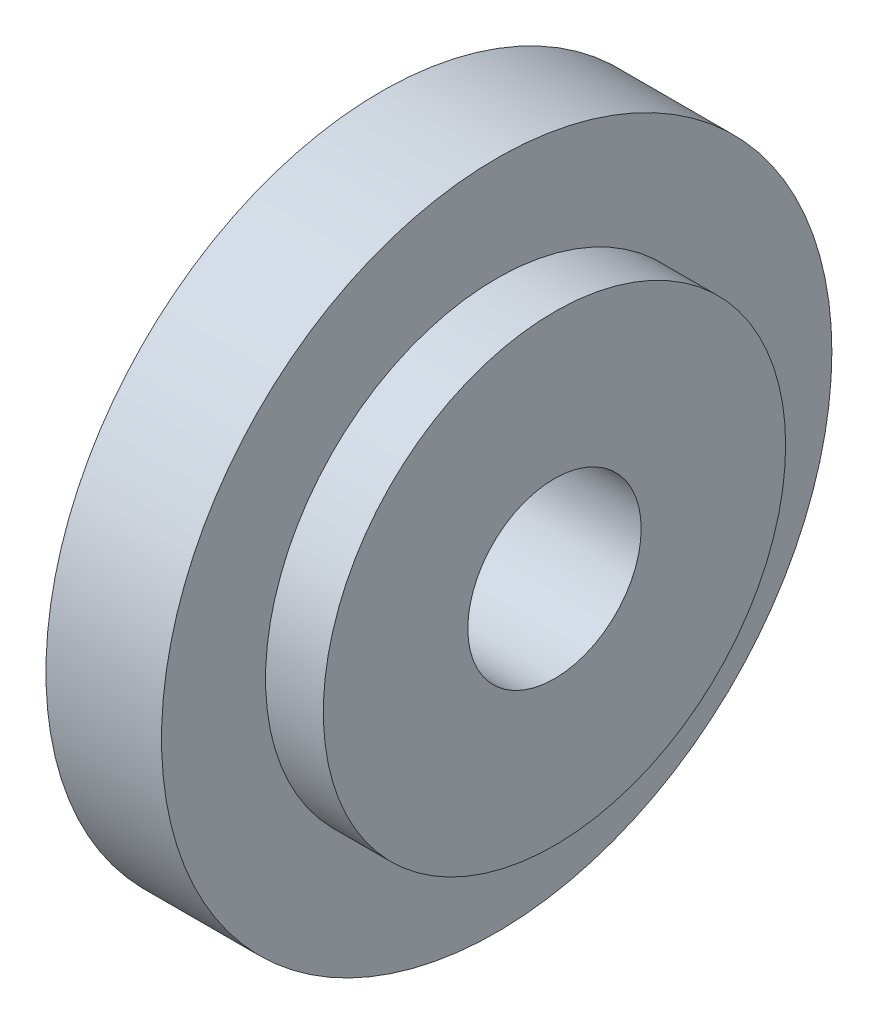
from build123d import *

# Parameters (mm, degrees)
SKETCH1_R           = 5.8
BOSS_EXTRUDE1_DEPTH = 2
SKETCH2_R           = 4
BOSS_EXTRUDE2_DEPTH = 1
SKETCH3_R           = 1.5
CUT_EXTRUDE1_DEPTH  = 20


with BuildPart() as part:
    # Sketch1 → Boss-Extrude1 (new body)
    with BuildSketch(Plane(origin=(0, 0, 0), x_dir=(0, 0, -1), z_dir=(1, 0, 0))):
        Circle(SKETCH1_R)
    extrude(amount=BOSS_EXTRUDE1_DEPTH)

    # Sketch2 → Boss-Extrude2 (add)
    with BuildSketch(Plane(origin=(2, 0, 0), x_dir=(0, 0, -1), z_dir=(1, 0, 0))):
        Circle(SKETCH2_R)
    extrude(amount=BOSS_EXTRUDE2_DEPTH)

    # Sketch3 → Cut-Extrude1 (cut)
    with BuildSketch(Plane.ZY):
        Circle(SKETCH3_R)
    extrude(amount=-CUT_EXTRUDE1_DEPTH, mode=Mode.SUBTRACT)


solid = part.part
